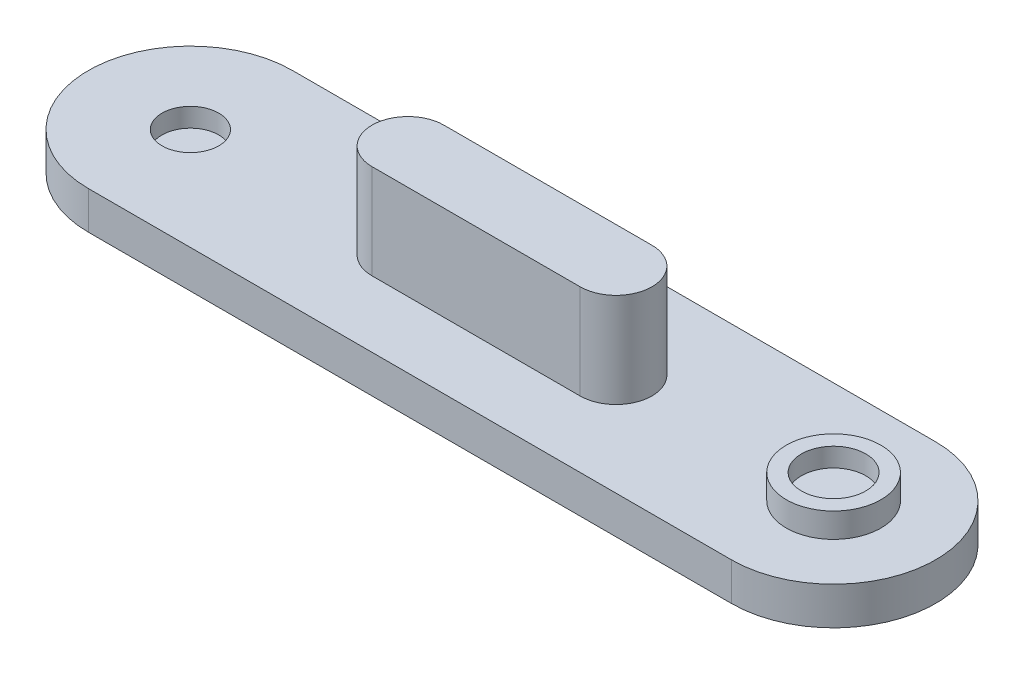
from build123d import *

# Parameters (mm, degrees)
BOSS_EXTRUDE1_DEPTH = 5
SKETCH2_R           = 3.75
CUT_EXTRUDE1_DEPTH  = 2.5
SKETCH3_R           = 6.25
BOSS_EXTRUDE3_DEPTH = 3.25
SKETCH4_R           = 4.25
CUT_EXTRUDE2_DEPTH  = 2.5
BOSS_EXTRUDE4_DEPTH = 12.5


with BuildPart() as part:
    # Sketch1 → Boss-Extrude1 (new body)
    with BuildSketch(Plane(origin=(0, 0, 0), x_dir=(1, 0, 0), z_dir=(0, 1, 0))):
        with BuildLine():
            Line((-42.5, -13.5), (42.5, -13.5))
            ThreePointArc((42.5, -13.5), (56, 0), (42.5, 13.5))
            Line((42.5, 13.5), (-42.5, 13.5))
            ThreePointArc((-42.5, 13.5), (-56, 0), (-42.5, -13.5))
        make_face()
    extrude(amount=BOSS_EXTRUDE1_DEPTH)

    # Sketch2 → Cut-Extrude1 (cut)
    with BuildSketch(Plane(origin=(0, 5, 0), x_dir=(1, 0, 0), z_dir=(0, 1, 0))):
        with Locations((-42.5, 0)):
            Circle(SKETCH2_R)
    extrude(amount=-CUT_EXTRUDE1_DEPTH, mode=Mode.SUBTRACT)

    # Sketch3 → Boss-Extrude3 (add)
    with BuildSketch(Plane(origin=(0, 5, 0), x_dir=(1, 0, 0), z_dir=(0, 1, 0))):
        with Locations((42.5, 0)):
            Circle(SKETCH3_R)
    extrude(amount=BOSS_EXTRUDE3_DEPTH)

    # Sketch4 → Cut-Extrude2 (cut)
    with BuildSketch(Plane(origin=(0, 8.25, 0), x_dir=(1, 0, 0), z_dir=(0, 1, 0))):
        with Locations((42.5, 0)):
            Circle(SKETCH4_R)
    extrude(amount=-CUT_EXTRUDE2_DEPTH, mode=Mode.SUBTRACT)

    # Sketch5 → Boss-Extrude4 (add)
    with BuildSketch(Plane(origin=(0, 5, 0), x_dir=(1, 0, 0), z_dir=(0, 1, 0))):
        with BuildLine():
            Line((-13.75, 4.75), (13.75, 4.75))
            ThreePointArc((13.75, 4.75), (18.5, 0), (13.75, -4.75))
            Line((13.75, -4.75), (-13.75, -4.75))
            ThreePointArc((-13.75, -4.75), (-18.5, 0), (-13.75, 4.75))
        make_face()
    extrude(amount=BOSS_EXTRUDE4_DEPTH)


solid = part.part
